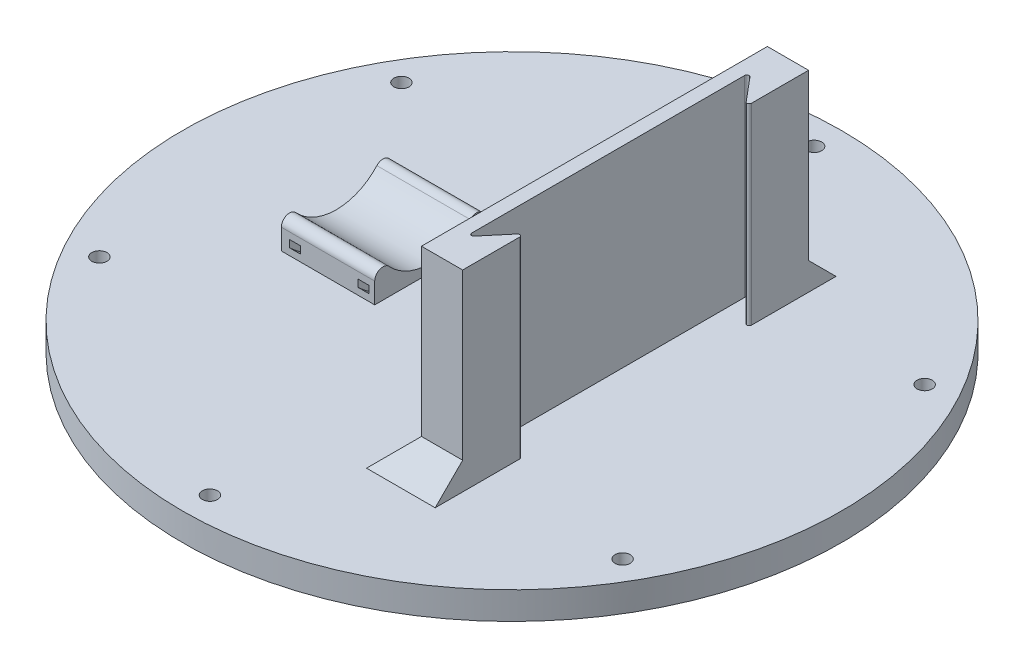
from build123d import *

# Parameters (mm, degrees)
SKETCH1_R           = 127
BOSS_EXTRUDE1_DEPTH = 19.05
CUT_EXTRUDE1_DEPTH  = 19.05
BOSS_EXTRUDE2_DEPTH = 43.18
FILLET1_R           = 3.81
CUT_EXTRUDE4_START  = -5.08
SKETCH7_R           = 36.385525633
SKETCH7_R_2         = 34.07613751
CUT_EXTRUDE4_DEPTH  = 2.54
CUT_EXTRUDE5_START  = -36.83
SKETCH8_R           = 36.385525633
SKETCH8_R_2         = 34.07613751
CUT_EXTRUDE5_DEPTH  = 2.54
SKETCH4_R           = 152.4
SKETCH4_R_2         = 127
BOSS_EXTRUDE3_DEPTH = 190.5
CUT_EXTRUDE2_START  = 12.7
CUT_EXTRUDE2_DEPTH  = 12.7
CUT_EXTRUDE6_START  = -12.7
SKETCH6_R           = 3.51155
CUT_EXTRUDE6_DEPTH  = 171.45
BOSS_EXTRUDE4_DEPTH = 88.9
CUT_EXTRUDE8_DEPTH  = 88.9
FILLET2_R           = 1.016
CUT_EXTRUDE9_START  = -16.51
CUT_EXTRUDE9_DEPTH  = 16.51
CUT_EXTRUDE12_START = -171.45
SKETCH14_R          = 152.4
SKETCH14_R_2        = 127
CUT_EXTRUDE12_DEPTH = 171.45
SKETCH15_R          = 152.4
CUT_EXTRUDE13_DEPTH = 6.35
SKETCH17_W          = 19.05
SKETCH17_H          = 41.16468875
CUT_EXTRUDE15_DEPTH = 88.9
CHAMFER2_SIZE       = 12.7


with BuildPart() as part:
    # Sketch1 → Boss-Extrude1 (new body)
    with BuildSketch(Plane(origin=(0, 0, 0), x_dir=(1, 0, 0), z_dir=(0, 1, 0))):
        with Locations(Location((0, 0, 0), (0, 0, 90))):
            Circle(SKETCH1_R)
    extrude(amount=BOSS_EXTRUDE1_DEPTH)

    # Sketch2 → Cut-Extrude1 (cut)
    with BuildSketch(Plane(origin=(0, 19.05, 0), x_dir=(1, 0, 0), z_dir=(0, 1, 0))):
        with BuildLine():
            Line((-16.764, 16.002), (-16.764, -16.002))
            Line((-16.764, -16.002), (0.678310948, -15.224897184))
            ThreePointArc((0.678310948, -15.224897184), (15.24, 0), (0.678310948, 15.224897184))
            Line((0.678310948, 15.224897184), (-16.764, 16.002))
        make_face()
    extrude(amount=-CUT_EXTRUDE1_DEPTH, mode=Mode.SUBTRACT)

    # Sketch3 → Boss-Extrude2 (add)
    with BuildSketch(Plane(origin=(-38.1, 0, 0), x_dir=(0, 0, -1), z_dir=(1, 0, 0))):
        with BuildLine():
            Line((-25.4, 19.05), (25.4, 19.05))
            Line((25.4, 19.05), (25.4, 48.26))
            ThreePointArc((25.4, 48.26), (0, 22.86), (-25.4, 48.26))
            Line((-25.4, 48.26), (-25.4, 19.05))
        make_face()
    extrude(amount=-BOSS_EXTRUDE2_DEPTH)

    # Fillet1
    fillet1_edges = [part.edges().sort_by_distance(p)[0] for p in [
        (-59.69, 48.26, 25.4),
        (-59.69, 48.26, -25.4),
    ]]
    fillet(fillet1_edges, radius=FILLET1_R - 0.0001)  # a hair under: the kernel refuses the full size

    # Sketch7 → Cut-Extrude4 (cut, symmetric)
    with BuildSketch(Plane(origin=(-38.1, 0, 0), x_dir=(0, 0, -1), z_dir=(1, 0, 0)).offset(CUT_EXTRUDE4_START)):
        with Locations((0, 48.26)):
            Circle(SKETCH7_R)
        with Locations((0, 48.26)):
            Circle(SKETCH7_R_2, mode=Mode.SUBTRACT)
    extrude(amount=CUT_EXTRUDE4_DEPTH, both=True, mode=Mode.SUBTRACT)

    # Sketch8 → Cut-Extrude5 (cut, symmetric)
    with BuildSketch(Plane(origin=(-38.1, 0, -38.1), x_dir=(0, 0, -1), z_dir=(1, 0, 0)).offset(CUT_EXTRUDE5_START)):
        with Locations((-38.1, 48.26)):
            Circle(SKETCH8_R)
        with Locations((-38.1, 48.26)):
            Circle(SKETCH8_R_2, mode=Mode.SUBTRACT)
    extrude(amount=CUT_EXTRUDE5_DEPTH, both=True, mode=Mode.SUBTRACT)

    # Sketch4 → Boss-Extrude3 (add)
    with BuildSketch(Plane(origin=(0, 0, 0), x_dir=(1, 0, 0), z_dir=(0, 1, 0))):
        with Locations(Location((0, 0, 0), (0, 0, 270))):
            Circle(SKETCH4_R)
        with Locations(Location((0, 0, 0), (0, 0, 270))):
            Circle(SKETCH4_R_2, mode=Mode.SUBTRACT)
    extrude(amount=BOSS_EXTRUDE3_DEPTH)

    # Sketch5 → Cut-Extrude2 (cut)
    with BuildSketch(Plane(origin=(0, 190.5, -228.6), x_dir=(1, 0, 0), z_dir=(0, -1, 0)).offset(CUT_EXTRUDE2_START)):
        with BuildLine():
            Line((-25.4, 351.737617729), (-25.4, 378.868426491))
            ThreePointArc((-25.4, 378.868426491), (0, 381), (25.4, 378.868426491))
            Line((25.4, 378.868426491), (25.4, 351.737617729))
            ThreePointArc((25.4, 351.737617729), (62.865, 337.485374018), (93.940305115, 312.165854121))
            Line((93.940305115, 312.165854121), (117.436274728, 325.731258501))
            ThreePointArc((117.436274728, 325.731258501), (131.982271537, 304.8), (142.836274728, 281.737167989))
            Line((142.836274728, 281.737167989), (119.340305115, 268.171763608))
            ThreePointArc((119.340305115, 268.171763608), (125.73, 228.6), (119.340305115, 189.028236392))
            Line((119.340305115, 189.028236392), (142.836274728, 175.462832011))
            ThreePointArc((142.836274728, 175.462832011), (131.982271537, 152.4), (117.436274728, 131.468741499))
            Line((117.436274728, 131.468741499), (93.940305115, 145.034145879))
            ThreePointArc((93.940305115, 145.034145879), (62.865, 119.714625982), (25.4, 105.462382271))
            Line((25.4, 105.462382271), (25.4, 78.331573509))
            ThreePointArc((25.4, 78.331573509), (0, 76.2), (-25.4, 78.331573509))
            Line((-25.4, 78.331573509), (-25.4, 105.462382271))
            ThreePointArc((-25.4, 105.462382271), (-62.865, 119.714625982), (-93.940305115, 145.034145879))
            Line((-93.940305115, 145.034145879), (-117.436274728, 131.468741499))
            ThreePointArc((-117.436274728, 131.468741499), (-131.982271537, 152.4), (-142.836274728, 175.462832011))
            Line((-142.836274728, 175.462832011), (-119.340305115, 189.028236392))
            ThreePointArc((-119.340305115, 189.028236392), (-125.73, 228.6), (-119.340305115, 268.171763608))
            Line((-119.340305115, 268.171763608), (-142.836274728, 281.737167989))
            ThreePointArc((-142.836274728, 281.737167989), (-131.982271537, 304.8), (-117.436274728, 325.731258501))
            Line((-117.436274728, 325.731258501), (-93.940305115, 312.165854121))
            ThreePointArc((-93.940305115, 312.165854121), (-62.865, 337.485374018), (-25.4, 351.737617729))
        make_face()
    extrude(amount=-CUT_EXTRUDE2_DEPTH, mode=Mode.SUBTRACT)

    # Sketch6 → Cut-Extrude6 (cut)
    with BuildSketch(Plane(origin=(0, 190.5, 0), x_dir=(1, 0, 0), z_dir=(0, 1, 0)).offset(CUT_EXTRUDE6_START)):
        with Locations(Location((0, 139.7, 0), (0, 0, 90))):
            Circle(SKETCH6_R)
        with Locations(Location((120.983748909, 69.85, 0), (0, 0, 90))):
            Circle(SKETCH6_R)
        with Locations(Location((120.983748909, -69.85, 0), (0, 0, 90))):
            Circle(SKETCH6_R)
        with Locations(Location((0, -139.7, 0), (0, 0, 90))):
            Circle(SKETCH6_R)
        with Locations(Location((-120.983748909, -69.85, 0), (0, 0, 90))):
            Circle(SKETCH6_R)
        with Locations(Location((-120.983748909, 69.85, 0), (0, 0, 90))):
            Circle(SKETCH6_R)
    extrude(amount=-CUT_EXTRUDE6_DEPTH, mode=Mode.SUBTRACT)

    # Sketch9 → Boss-Extrude4 (add)
    with BuildSketch(Plane(origin=(0, 19.05, 0), x_dir=(1, 0, 0), z_dir=(0, 1, 0))):
        with BuildLine():
            Line((38.1, 121.15027858), (38.1, -121.15027858))
            ThreePointArc((38.1, -121.15027858), (47.781803057, -117.668599451), (57.15, -113.414626482))
            Line((57.15, -113.414626482), (57.15, 113.414626482))
            ThreePointArc((57.15, 113.414626482), (47.781803057, 117.668599451), (38.1, 121.15027858))
        make_face()
    extrude(amount=BOSS_EXTRUDE4_DEPTH)

    # Sketch10 → Cut-Extrude8 (cut)
    with BuildSketch(Plane(origin=(0, 107.95, 0), x_dir=(1, 0, 0), z_dir=(0, 1, 0))):
        Polygon((57.15, -50.8), (57.15, 50.8), (44.45, 65.935270626), (44.45, -65.935270626), align=None)
    extrude(amount=-CUT_EXTRUDE8_DEPTH, mode=Mode.SUBTRACT)

    # Fillet2
    fillet2_edges = [part.edges().sort_by_distance(p)[0] for p in [
        (44.45, 63.5, 65.935270626),
        (44.45, 63.5, -65.935270626),
        (57.15, 63.5, -50.8),
        (57.15, 63.5, 50.8),
    ]]
    fillet(fillet2_edges, radius=FILLET2_R)

    # Sketch11 → Cut-Extrude9 (cut)
    with BuildSketch(Plane.XZ.offset(CUT_EXTRUDE9_START)):
        with BuildLine():
            Line((-29.464, 29.280418015), (-29.464, -29.280418015))
            Line((-29.464, -29.280418015), (1.243570072, -27.912311504))
            ThreePointArc((1.243570072, -27.912311504), (27.94, 0), (1.243570072, 27.912311504))
            Line((1.243570072, 27.912311504), (-29.464, 29.280418015))
        make_face()
        with BuildLine():
            Line((-16.764, 16.002), (-16.764, -16.002))
            Line((-16.764, -16.002), (0.678310948, -15.224897184))
            ThreePointArc((0.678310948, -15.224897184), (15.24, 0), (0.678310948, 15.224897184))
            Line((0.678310948, 15.224897184), (-16.764, 16.002))
        make_face(mode=Mode.SUBTRACT)
    extrude(amount=CUT_EXTRUDE9_DEPTH, mode=Mode.SUBTRACT)

    # Sketch14 → Cut-Extrude12 (cut)
    with BuildSketch(Plane(origin=(0, 190.5, 0), x_dir=(1, 0, 0), z_dir=(0, 1, 0)).offset(CUT_EXTRUDE12_START)):
        with Locations(Location((0, 0, 0), (0, 0, 270))):
            Circle(SKETCH14_R)
        Circle(SKETCH14_R_2, mode=Mode.SUBTRACT)
    extrude(amount=CUT_EXTRUDE12_DEPTH, mode=Mode.SUBTRACT)

    # Sketch15 → Cut-Extrude13 (cut)
    with BuildSketch(Plane.XZ):
        with Locations(Location((0, 0, 0), (0, 0, 270))):
            Circle(SKETCH15_R)
    extrude(amount=-CUT_EXTRUDE13_DEPTH, mode=Mode.SUBTRACT)

    # Sketch17 → Cut-Extrude15 (cut)
    with BuildSketch(Plane(origin=(0, 107.95, 0), x_dir=(1, 0, 0), z_dir=(0, 1, 0))):
        with Locations((47.625, 100.567934205)):
            Rectangle(SKETCH17_W, SKETCH17_H)
        with Locations((47.625, -100.567934205)):
            Rectangle(SKETCH17_W, SKETCH17_H)
    extrude(amount=-CUT_EXTRUDE15_DEPTH, mode=Mode.SUBTRACT)

    # Chamfer2
    chamfer2_edges = [part.edges().sort_by_distance(p)[0] for p in [
        (38.1, 19.05, 0),
        (47.625, 19.05, -79.98558983),
        (47.625, 19.05, 79.98558983),
    ]]
    chamfer(chamfer2_edges, length=CHAMFER2_SIZE)


solid = part.part
